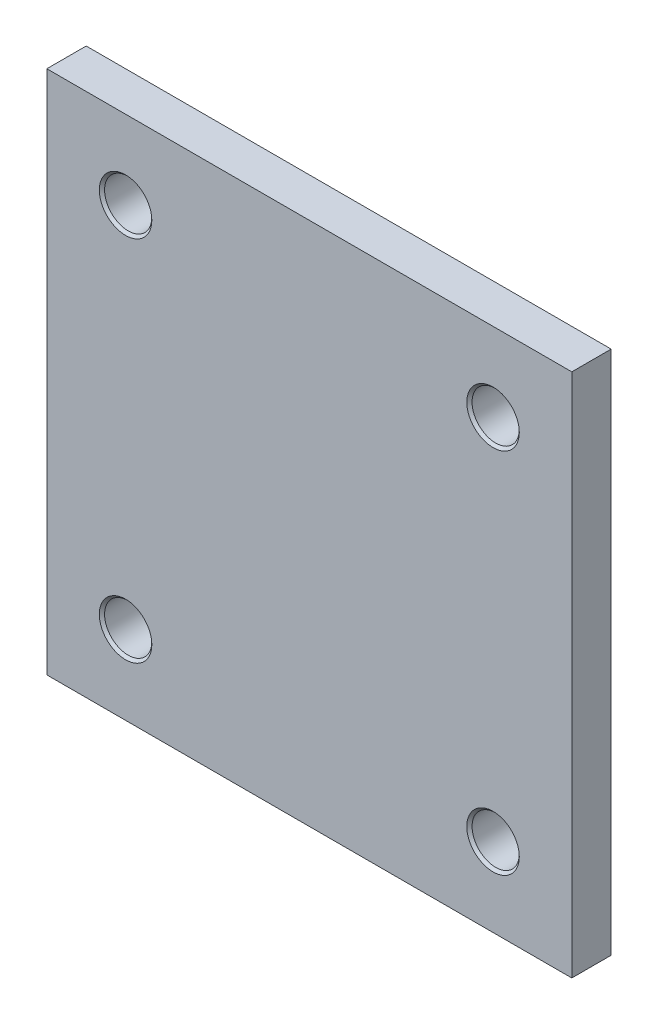
from build123d import *

# Parameters (mm, degrees)
IZIM1_W                          = 400
IZIM1_H                          = 400
Y_KSEKLIK_EKSTR_ZYON1_DEPTH      = 30
F_25_5_25_5_AP_DELIK1_AT_2_COUNT = 2
F_25_5_25_5_AP_DELIK1_AT_2_PITCH = 280
F_25_5_25_5_AP_DELIK1_AT_3_COUNT = 2
F_25_5_25_5_AP_DELIK1_AT_3_PITCH = 395.979797464
F_25_5_25_5_AP_DELIK1_AT_4_COUNT = 2
F_25_5_25_5_AP_DELIK1_AT_4_PITCH = 280


with BuildPart() as part:
    # Çizim1 → Yükseklik-Ekstrüzyon1 (new body)
    with BuildSketch(Plane.XY):
        Rectangle(IZIM1_W, IZIM1_H)
    extrude(amount=Y_KSEKLIK_EKSTR_ZYON1_DEPTH)

    # Çizim3 → Ø25.5 (25.5) Çap Delik1 (revolve, cut)
    with BuildSketch(Plane(origin=(140, 140, 30), x_dir=(0, -1, 0), z_dir=(1, 0, 0))):
        Polygon((0, 0), (0, 30), (20, 30), (18, 28), (18, 2), (20, 0), align=None)
    f_25_5_25_5_ap_delik1 = revolve(axis=Axis((140, 140, 36.35), (0, 0, -1)), mode=Mode.SUBTRACT)

    # Ø25.5 (25.5) Çap Delik1 at 2: Ø25.5 (25.5) Çap Delik1 ×2
    with Locations(*[(-i * F_25_5_25_5_AP_DELIK1_AT_2_PITCH, 0, 0) for i in range(1, F_25_5_25_5_AP_DELIK1_AT_2_COUNT)]):
        add(f_25_5_25_5_ap_delik1, mode=Mode.SUBTRACT)

    # Ø25.5 (25.5) Çap Delik1 at 3: Ø25.5 (25.5) Çap Delik1 ×2
    with Locations(*[Vector(-0.7071067811865476, -0.7071067811865476, 0) * (i * F_25_5_25_5_AP_DELIK1_AT_3_PITCH) for i in range(1, F_25_5_25_5_AP_DELIK1_AT_3_COUNT)]):
        add(f_25_5_25_5_ap_delik1, mode=Mode.SUBTRACT)

    # Ø25.5 (25.5) Çap Delik1 at 4: Ø25.5 (25.5) Çap Delik1 ×2
    with Locations(*[(0, -i * F_25_5_25_5_AP_DELIK1_AT_4_PITCH, 0) for i in range(1, F_25_5_25_5_AP_DELIK1_AT_4_COUNT)]):
        add(f_25_5_25_5_ap_delik1, mode=Mode.SUBTRACT)


solid = part.part
